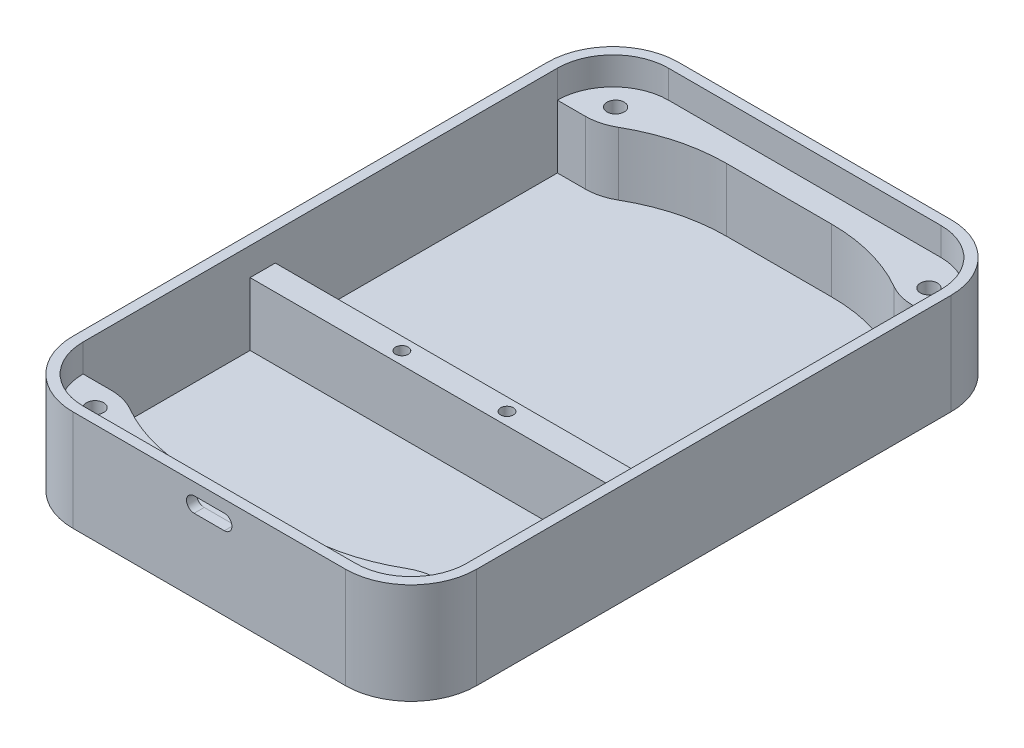
from build123d import *

# Parameters (mm, degrees)
SALIENTE_EXTRUIR1_DEPTH = 20
VACIADO1_T              = -2
CROQUIS2_R              = 1.25
CROQUIS2_W              = 76
CROQUIS2_H              = 5
SALIENTE_EXTRUIR2_DEPTH = 12.5
CORTAR_EXTRUIR1_REACH   = 130.062
CORTAR_EXTRUIR2_REACH   = 75.554
CROQUIS4_R              = 1.7
CORTAR_EXTRUIR3_DEPTH   = 4


with BuildPart() as part:
    # Croquis1 → Saliente-Extruir1 (new body)
    with BuildSketch(Plane(origin=(0, 0, 0), x_dir=(1, 0, 0), z_dir=(0, 1, 0))):
        with BuildLine():
            Line((-27, 60), (27, 60))
            ThreePointArc((27, 60), (36.192388155, 56.192388155), (40, 47))
            Line((40, 47), (40, -47))
            ThreePointArc((40, -47), (36.192388155, -56.192388155), (27, -60))
            Line((27, -60), (-27, -60))
            ThreePointArc((-27, -60), (-36.192388155, -56.192388155), (-40, -47))
            Line((-40, -47), (-40, 47))
            ThreePointArc((-40, 47), (-36.192388155, 56.192388155), (-27, 60))
        make_face()
    extrude(amount=SALIENTE_EXTRUIR1_DEPTH)

    # Vaciado1
    vaciado1_openings = [part.faces().sort_by_distance(p)[0] for p in [
        (0, 20, 0),
    ]]
    offset(amount=VACIADO1_T, openings=vaciado1_openings, kind=Kind.INTERSECTION)

    # Croquis2 → Saliente-Extruir2 (add)
    # profile 1 of 3: a face of its own
    with BuildSketch(Plane(origin=(0, 2, 0), x_dir=(1, 0, 0), z_dir=(0, 1, 0))):
        with BuildLine():
            Line((-27, -58), (27, -58))
            ThreePointArc((27, -58), (34.778174593, -54.778174593), (38, -47))
            Line((38, -47), (32.47106585, -47))
            ThreePointArc((32.47106585, -47), (29.804463421, -47.350496484), (27.319007566, -48.378176148))
            ThreePointArc((27.319007566, -48.378176148), (19.164176572, -51.750013938), (10.415, -52.9))
            Line((10.415, -52.9), (-10.415, -52.9))
            ThreePointArc((-10.415, -52.9), (-19.164176572, -51.750013938), (-27.319007566, -48.378176148))
            ThreePointArc((-27.319007566, -48.378176148), (-29.804463421, -47.350496484), (-32.47106585, -47))
            Line((-32.47106585, -47), (-38, -47))
            ThreePointArc((-38, -47), (-34.778174593, -54.778174593), (-27, -58))
        make_face()
        with Locations((-10.415, -55.1)):
            Circle(CROQUIS2_R, mode=Mode.SUBTRACT)
        with Locations((10.415, -55.1)):
            Circle(CROQUIS2_R, mode=Mode.SUBTRACT)
    # profile 2 of 3: a face of its own
    with BuildSketch(Plane(origin=(0, 2, 0), x_dir=(1, 0, 0), z_dir=(0, 1, 0))):
        with Locations((0, -11.41)):
            Rectangle(CROQUIS2_W, CROQUIS2_H)
        with Locations((-10.415, -11.41)):
            Circle(CROQUIS2_R, mode=Mode.SUBTRACT)
        with Locations((10.415, -11.41)):
            Circle(CROQUIS2_R, mode=Mode.SUBTRACT)
    # profile 3 of 3: a face of its own
    with BuildSketch(Plane(origin=(0, 2, 0), x_dir=(1, 0, 0), z_dir=(0, 1, 0))):
        with BuildLine():
            Line((32.47106585, 47), (38, 47))
            ThreePointArc((38, 47), (34.778174593, 54.778174593), (27, 58))
            Line((27, 58), (-27, 58))
            ThreePointArc((-27, 58), (-34.778174593, 54.778174593), (-38, 47))
            Line((-38, 47), (-32.47106585, 47))
            ThreePointArc((-32.47106585, 47), (-29.804463421, 47.350496484), (-27.319007566, 48.378176148))
            ThreePointArc((-27.319007566, 48.378176148), (-19.164176572, 51.750013938), (-10.415, 52.9))
            Line((-10.415, 52.9), (10.415, 52.9))
            ThreePointArc((10.415, 52.9), (19.164176572, 51.750013938), (27.319007566, 48.378176148))
            ThreePointArc((27.319007566, 48.378176148), (29.804463421, 47.350496484), (32.47106585, 47))
        make_face()
    extrude(amount=SALIENTE_EXTRUIR2_DEPTH)

    # Croquis3 → Cortar-Extruir1 (cut, up to next)
    with BuildSketch(Plane.XY.offset(60), mode=Mode.PRIVATE) as cortar_extruir1_sk1:
        with BuildLine():
            Line((-3, 14.6), (3, 14.6))
            ThreePointArc((3, 14.6), (4.5, 16.1), (3, 17.6))
            Line((3, 17.6), (-3, 17.6))
            ThreePointArc((-3, 17.6), (-4.5, 16.1), (-3, 14.6))
        make_face()
    cortar_extruir1_tool1 = extrude(cortar_extruir1_sk1.sketch, amount=-CORTAR_EXTRUIR1_REACH, mode=Mode.PRIVATE) & part.part
    add(cortar_extruir1_tool1.solids().sort_by_distance((0, 16.1, 60))[0], mode=Mode.SUBTRACT)

    # Croquis4 → Cortar-Extruir2 (cut, up to next)
    with BuildSketch(Plane(origin=(0, 14.5, 0), x_dir=(1, 0, 0), z_dir=(0, 1, 0)), mode=Mode.PRIVATE) as cortar_extruir2_sk1:
        with Locations((-31.04859108, 51.57817537)):
            Circle(CROQUIS4_R)
    cortar_extruir2_tool1 = extrude(cortar_extruir2_sk1.sketch, amount=-CORTAR_EXTRUIR2_REACH, mode=Mode.PRIVATE) & part.part
    # Croquis4 → Cortar-Extruir2 (cut, up to next)
    with BuildSketch(Plane(origin=(0, 14.5, 0), x_dir=(1, 0, 0), z_dir=(0, 1, 0)), mode=Mode.PRIVATE) as cortar_extruir2_sk2:
        with Locations((31.04859108, 51.57817537)):
            Circle(CROQUIS4_R)
    cortar_extruir2_tool2 = extrude(cortar_extruir2_sk2.sketch, amount=-CORTAR_EXTRUIR2_REACH, mode=Mode.PRIVATE) & part.part
    # Croquis4 → Cortar-Extruir2 (cut, up to next)
    with BuildSketch(Plane(origin=(0, 14.5, 0), x_dir=(1, 0, 0), z_dir=(0, 1, 0)), mode=Mode.PRIVATE) as cortar_extruir2_sk3:
        with Locations((31.04859108, -51.57817537)):
            Circle(CROQUIS4_R)
    cortar_extruir2_tool3 = extrude(cortar_extruir2_sk3.sketch, amount=-CORTAR_EXTRUIR2_REACH, mode=Mode.PRIVATE) & part.part
    # Croquis4 → Cortar-Extruir2 (cut, up to next)
    with BuildSketch(Plane(origin=(0, 14.5, 0), x_dir=(1, 0, 0), z_dir=(0, 1, 0)), mode=Mode.PRIVATE) as cortar_extruir2_sk4:
        with Locations((-31.04859108, -51.57817537)):
            Circle(CROQUIS4_R)
    cortar_extruir2_tool4 = extrude(cortar_extruir2_sk4.sketch, amount=-CORTAR_EXTRUIR2_REACH, mode=Mode.PRIVATE) & part.part
    add(cortar_extruir2_tool1.solids().sort_by_distance((-31.048591, 14.5, -51.578175))[0], mode=Mode.SUBTRACT)
    add(cortar_extruir2_tool2.solids().sort_by_distance((31.048591, 14.5, -51.578175))[0], mode=Mode.SUBTRACT)
    add(cortar_extruir2_tool3.solids().sort_by_distance((31.048591, 14.5, 51.578175))[0], mode=Mode.SUBTRACT)
    add(cortar_extruir2_tool4.solids().sort_by_distance((-31.048591, 14.5, 51.578175))[0], mode=Mode.SUBTRACT)

    # Croquis5 → Cortar-Extruir3 (cut)
    with BuildSketch(Plane.XZ):
        Polygon((-34.09859108, 53.339093692), (-34.09859108, 49.817257049), (-31.04859108, 48.056338728), (-27.99859108, 49.817257049), (-27.99859108, 53.339093692), (-31.04859108, 55.100012013), align=None)
        Polygon((31.04859108, 55.100012013), (34.09859108, 53.339093692), (34.09859108, 49.817257049), (31.04859108, 48.056338728), (27.99859108, 49.817257049), (27.99859108, 53.339093692), align=None)
        Polygon((34.09859108, -53.339093692), (34.09859108, -49.817257049), (31.04859108, -48.056338728), (27.99859108, -49.817257049), (27.99859108, -53.339093692), (31.04859108, -55.100012013), align=None)
        Polygon((-31.04859108, -55.100012013), (-34.09859108, -53.339093692), (-34.09859108, -49.817257049), (-31.04859108, -48.056338728), (-27.99859108, -49.817257049), (-27.99859108, -53.339093692), align=None)
    extrude(amount=-CORTAR_EXTRUIR3_DEPTH, mode=Mode.SUBTRACT)


solid = part.part
